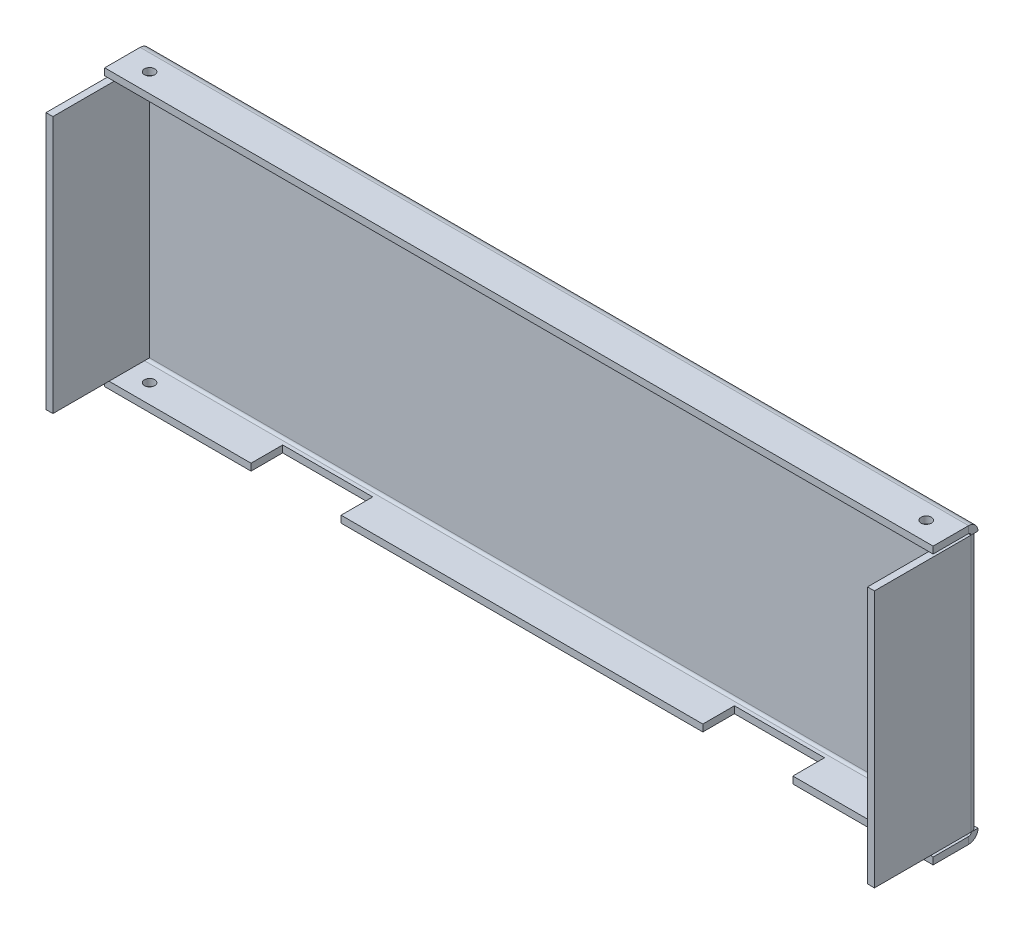
from build123d import *

# Parameters (mm, degrees)
SKETCH31_W                     = 240
SKETCH31_H                     = 80
BASE_FLANGE1_DEPTH             = 2
EDGE_FLANGE1_STRIP_W           = 9.4732
EDGE_FLANGE1_STRIP_H           = 2
EDGE_FLANGE1_STRIP_CUT_DEPTH   = 240
EDGE_FLANGE1_STRIP_2_W         = 9.4732
EDGE_FLANGE1_STRIP_2_H         = 2
EDGE_FLANGE1_STRIP_CUT_2_DEPTH = 240
EDGE_FLANGE1_DEPTH             = 240
EDGE_FLANGE1_BEND_DEPTH        = 240
EDGE_FLANGE2_START             = -32.381792537
EDGE_FLANGE2_DEPTH             = 74.5268
EDGE_FLANGE2_2_OUTLINE_W       = 2
EDGE_FLANGE2_2_OUTLINE_H       = 28
EDGE_FLANGE2_2_DEPTH           = 74.5268
SKETCH52_W                     = 26.086706926
SKETCH52_H                     = 9.115658902
CUT_EXTRUDE2_DEPTH             = 10
SKETCH53_W                     = 26.086706926
SKETCH53_H                     = 0.049167759
CUT_EXTRUDE3_DEPTH             = 10
SKETCH61_R                     = 1.5
CUT_EXTRUDE8_DEPTH             = 148.637805464
SKETCH62_R                     = 1.5
CUT_EXTRUDE9_DEPTH             = 148.637805464


# Read off the part's stored shape, not the designer's step: Edge-Flange2
# Sheet-metal steps are written as plain solids
with BuildPart() as part:
    # Sketch31 → Base-Flange1 (new body)
    with BuildSketch(Plane.XY):
        with Locations((-0.883917881, 4.881607463)):
            Rectangle(SKETCH31_W, SKETCH31_H)
    extrude(amount=-BASE_FLANGE1_DEPTH)

    # Edge-Flange1 strip (across the edge) → Edge-Flange1 strip cut (cut)
    with BuildSketch(Plane(origin=(119.116082119, 44.881607463, 0), x_dir=(0, -1, 0), z_dir=(-1, 0, 0))):
        with Locations((-2, -1)):
            Rectangle(EDGE_FLANGE1_STRIP_W, EDGE_FLANGE1_STRIP_H)
    extrude(amount=EDGE_FLANGE1_STRIP_CUT_DEPTH, mode=Mode.SUBTRACT)

    # Edge-Flange1 strip 2 (across the edge) → Edge-Flange1 strip cut 2 (cut)
    with BuildSketch(Plane(origin=(-120.883917881, -35.118392537, 0), x_dir=(0, 1, 0), z_dir=(1, 0, 0))):
        with Locations((-2, -1)):
            Rectangle(EDGE_FLANGE1_STRIP_2_W, EDGE_FLANGE1_STRIP_2_H)
    extrude(amount=EDGE_FLANGE1_STRIP_CUT_2_DEPTH, mode=Mode.SUBTRACT)

    # Edge-Flange1 section (across the edge) → Edge-Flange1 (add)
    with BuildSketch(Plane(origin=(119.116082119, 44.881607463, 0), x_dir=(0, -1, 0), z_dir=(-1, 0, 0))):
        with BuildLine():
            Line((0, 0.7366), (0, 11))
            Line((0, 11), (2, 11))
            Line((2, 11), (2, 0.7366))
            ThreePointArc((2, 0.7366), (2.215745145, 0.215745145), (2.7366, 0))
            Line((2.7366, 0), (2.7366, -2))
            ThreePointArc((2.7366, -2), (0.801531583, -1.198468417), (0, 0.7366))
        make_face()
    extrude(amount=EDGE_FLANGE1_DEPTH)

    # Edge-Flange1 section 2 (across the edge) → Edge-Flange1 bend (add)
    with BuildSketch(Plane(origin=(-120.883917881, -35.118392537, 0), x_dir=(0, 1, 0), z_dir=(1, 0, 0))):
        with BuildLine():
            Line((0, 0.7366), (0, 11))
            Line((0, 11), (2, 11))
            Line((2, 11), (2, 0.7366))
            ThreePointArc((2, 0.7366), (2.215745145, 0.215745145), (2.7366, 0))
            Line((2.7366, 0), (2.7366, -2))
            ThreePointArc((2.7366, -2), (0.801531583, -1.198468417), (0, 0.7366))
        make_face()
    extrude(amount=EDGE_FLANGE1_BEND_DEPTH)

    # Edge-Flange2 outline → Edge-Flange2 (cut)
    with BuildSketch(Plane(origin=(0, 0, 0), x_dir=(1, 0, 0), z_dir=(0, 1, 0)).offset(EDGE_FLANGE2_START)):
        with BuildLine():
            ThreePointArc((117.116082119, 2), (118.530295681, 1.414213562), (119.116082119, 0))
            Line((119.116082119, 0), (119.116082119, 2))
            Line((119.116082119, 2), (117.116082119, 2))
        make_face()
        with BuildLine():
            ThreePointArc((-120.883917881, 0), (-120.298131443, 1.414213562), (-118.883917881, 2))
            Line((-118.883917881, 2), (-120.883917881, 2))
            Line((-120.883917881, 2), (-120.883917881, 0))
        make_face()
    extrude(amount=EDGE_FLANGE2_DEPTH, mode=Mode.SUBTRACT)

    # Edge-Flange2 2 outline → Edge-Flange2 2 (add)
    with BuildSketch(Plane(origin=(0, 0, 0), x_dir=(1, 0, 0), z_dir=(0, 1, 0)).offset(EDGE_FLANGE2_START)):
        with Locations((118.116082119, -14)):
            Rectangle(EDGE_FLANGE2_2_OUTLINE_W, EDGE_FLANGE2_2_OUTLINE_H)
        with Locations((-119.883917881, -14)):
            Rectangle(EDGE_FLANGE2_2_OUTLINE_W, EDGE_FLANGE2_2_OUTLINE_H)
    extrude(amount=EDGE_FLANGE2_2_DEPTH)

    # Sketch52 → Cut-Extrude2 (cut)
    with BuildSketch(Plane(origin=(0, -33.118392537, 0), x_dir=(1, 0, 0), z_dir=(0, 1, 0))):
        with Locations((-65.439575559, -6.39300279)):
            Rectangle(SKETCH52_W, SKETCH52_H)
    cut_extrude2 = extrude(amount=-CUT_EXTRUDE2_DEPTH, mode=Mode.SUBTRACT)

    # Sketch53 → Cut-Extrude3 (cut)
    with BuildSketch(Plane(origin=(0, -33.118392537, 0), x_dir=(1, 0, 0), z_dir=(0, 1, 0))):
        with Locations((-65.439575559, -10.975416121)):
            Rectangle(SKETCH53_W, SKETCH53_H)
    cut_extrude3 = extrude(amount=-CUT_EXTRUDE3_DEPTH, mode=Mode.SUBTRACT)

    # Mirror3: Cut-Extrude3 across plane
    add(cut_extrude3.mirror(Plane(origin=(0, 0, 0), x_dir=(0, 0, 1), z_dir=(1, 0, 0))), mode=Mode.SUBTRACT)

    # Mirror4: Cut-Extrude2, Cut-Extrude3 across plane
    add(cut_extrude2.mirror(Plane(origin=(0, 0, 0), x_dir=(0, 0, 1), z_dir=(1, 0, 0))), mode=Mode.SUBTRACT)
    add(cut_extrude3.mirror(Plane(origin=(0, 0, 0), x_dir=(0, 0, 1), z_dir=(1, 0, 0))), mode=Mode.SUBTRACT)

    # Sketch61 → Cut-Extrude8 (cut, through all)
    with BuildSketch(Plane(origin=(0, 44.881607463, 0), x_dir=(1, 0, 0), z_dir=(0, 1, 0))):
        with Locations(Location((111.616082119, -5.4966, 0), (0, 0, 270))):
            Circle(SKETCH61_R)
    extrude(amount=-CUT_EXTRUDE8_DEPTH, mode=Mode.SUBTRACT)

    # Sketch62 → Cut-Extrude9 (cut, through all)
    with BuildSketch(Plane(origin=(0, 44.881607463, 0), x_dir=(1, 0, 0), z_dir=(0, 1, 0))):
        with Locations(Location((-113.383917881, -5.4966, 0), (0, 0, 270))):
            Circle(SKETCH62_R)
    extrude(amount=-CUT_EXTRUDE9_DEPTH, mode=Mode.SUBTRACT)


solid = part.part
